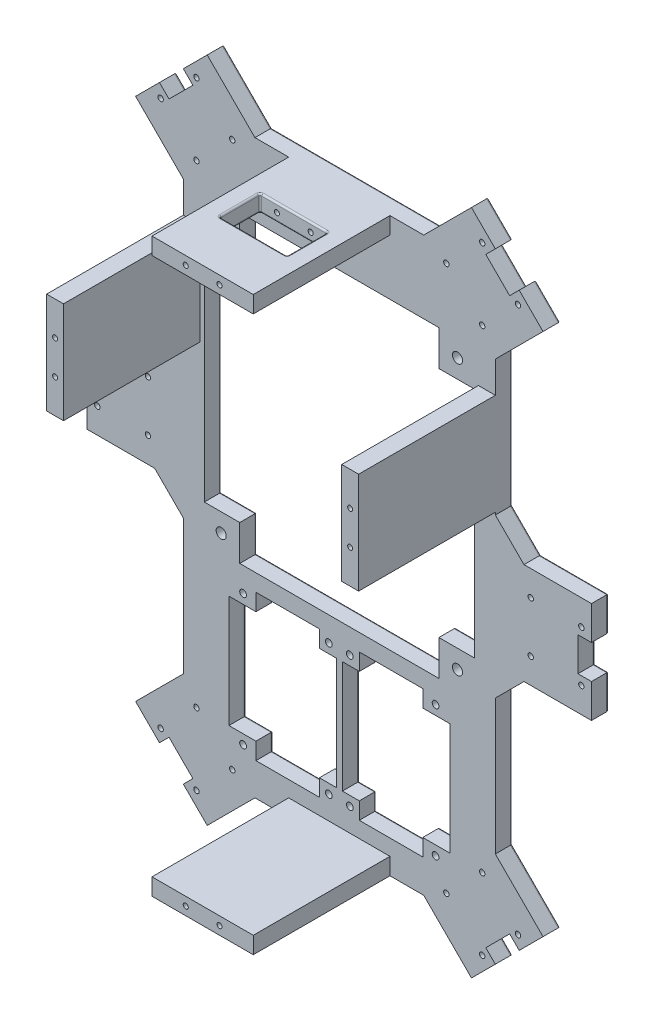
from build123d import *

# Parameters (mm, degrees)
DODANIE_WYCI_GNI_CIE1_DEPTH      = 5
WYTNIJ_WYCI_GNI_CIE3_DEPTH       = 16
WYTNIJ_WYCI_GNI_CIE3_DEPTH_BACK  = 4
SZKIC3_R                         = 0.8
WYTNIJ_WYCI_GNI_CIE4_DEPTH       = 26
WYTNIJ_WYCI_GNI_CIE4_DEPTH_BACK  = 52
SZKIC5_R                         = 1.5
WYTNIJ_WYCI_GNI_CIE5_DEPTH       = 31
WYTNIJ_WYCI_GNI_CIE5_DEPTH_BACK  = 69
WYTNIJ_WYCI_GNI_CIE6_DEPTH       = 22
WYTNIJ_WYCI_GNI_CIE6_DEPTH_BACK  = 83
SZKIC7_R                         = 1
SZKIC8_W                         = 30
SZKIC8_H                         = 5
DODANIE_WYCI_GNI_CIE2_DEPTH      = 45.5
SZKIC10_W                        = 30
SZKIC10_H                        = 5
DODANIE_WYCI_GNI_CIE3_DEPTH      = 40.5
WYTNIJ_WYCI_GNI_CIE7_DEPTH       = 112
WYTNIJ_WYCI_GNI_CIE7_DEPTH_BACK  = 158
SZKIC11_R                        = 0.75
WYTNIJ_WYCI_GNI_CIE8_DEPTH       = 220
WYTNIJ_WYCI_GNI_CIE8_DEPTH_BACK  = 402
SZKIC12_R                        = 0.75
SZKIC13_W                        = 5
SZKIC13_H                        = 30
DODANIE_WYCI_GNI_CIE4_DEPTH      = 40.5
WYTNIJ_WYCI_GNI_CIE9_DEPTH       = 48
WYTNIJ_WYCI_GNI_CIE9_DEPTH_BACK  = 85
SZKIC14_R                        = 0.75
ZAOKR_GLENIE1_R                  = 0.5
WYTNIJ_WYCI_GNI_CIE10_DEPTH      = 19
WYTNIJ_WYCI_GNI_CIE10_DEPTH_BACK = 21
SZKIC15_W                        = 20
SZKIC15_H                        = 12
ZAOKR_GLENIE2_R                  = 0.5


with BuildPart() as part:
    # Szkic1 → Dodanie-wyciągnięcie1 (new body)
    with BuildSketch(Plane.XY):
        Polygon((0, 0), (-50, 0), (-64.142135624, 14.142135624), (-71.213203436, 7.071067812), (-68.384776311, 4.242640687), (-75.455844123, -2.828427125), (-78.284271247, 0), (-85.355339059, -7.071067812), (-71.213203436, -21.213203436), (-71.213203436, -61.213203436), (-79.69848481, -69.69848481), (-99.69848481, -69.69848481), (-99.69848481, -79.69848481), (-95.69848481, -79.69848481), (-95.69848481, -89.69848481), (-99.69848481, -89.69848481), (-99.69848481, -99.69848481), (-79.69848481, -99.69848481), (-71.213203436, -108.183766184), (-71.213203436, -148.183766184), (-85.355339059, -162.325901808), (-78.284271247, -169.39696962), (-75.455844123, -166.568542495), (-68.384776311, -173.639610307), (-71.213203436, -176.468037432), (-64.142135624, -183.539105243), (-50, -169.39696962), (0, -169.39696962), (14.142135624, -183.539105243), (21.213203436, -176.468037432), (18.384776311, -173.639610307), (25.455844123, -166.568542495), (28.284271247, -169.39696962), (35.355339059, -162.325901808), (21.213203436, -148.183766184), (21.213203436, -108.183766184), (29.69848481, -99.69848481), (49.69848481, -99.69848481), (49.69848481, -89.69848481), (45.69848481, -89.69848481), (45.69848481, -79.69848481), (49.69848481, -79.69848481), (49.69848481, -69.69848481), (29.69848481, -69.69848481), (21.213203436, -61.213203436), (21.213203436, -21.213203436), (35.355339059, -7.071067812), (28.284271247, 0), (25.455844123, -2.828427125), (18.384776311, 4.242640687), (21.213203436, 7.071067812), (14.142135624, 14.142135624), align=None)
    extrude(amount=DODANIE_WYCI_GNI_CIE1_DEPTH)

    # Szkic3 → Wytnij-wyciągnięcie3 (cut, two sides: drawn at the far end of the back side and taken through both)
    with BuildSketch(Plane.XY.offset(-WYTNIJ_WYCI_GNI_CIE3_DEPTH_BACK)):
        with Locations((31.69848481, -77.19848481)):
            Circle(SZKIC3_R)
        with Locations((46.69848481, -77.19848481)):
            Circle(SZKIC3_R)
        with Locations((31.69848481, -92.19848481)):
            Circle(SZKIC3_R)
        with Locations((46.69848481, -92.19848481)):
            Circle(SZKIC3_R)
        with Locations((-81.69848481, -77.19848481)):
            Circle(SZKIC3_R)
        with Locations((-96.69848481, -77.19848481)):
            Circle(SZKIC3_R)
        with Locations((17.324116139, -154.901280605)):
            Circle(SZKIC3_R)
        with Locations((27.930717857, -165.507882323)):
            Circle(SZKIC3_R)
        with Locations((17.324116139, -176.114484041)):
            Circle(SZKIC3_R)
        with Locations((6.717514421, -165.507882323)):
            Circle(SZKIC3_R)
        with Locations((-67.324116139, -154.901280605)):
            Circle(SZKIC3_R)
        with Locations((-77.930717857, -165.507882323)):
            Circle(SZKIC3_R)
        with Locations((-67.324116139, -176.114484041)):
            Circle(SZKIC3_R)
        with Locations((-56.717514421, -165.507882323)):
            Circle(SZKIC3_R)
        with Locations((17.324116139, 6.717514421)):
            Circle(SZKIC3_R)
        with Locations((27.930717857, -3.889087297)):
            Circle(SZKIC3_R)
        with Locations((6.717514421, -3.889087297)):
            Circle(SZKIC3_R)
        with Locations((17.324116139, -14.495689014)):
            Circle(SZKIC3_R)
        with Locations((-67.324116139, 6.717514421)):
            Circle(SZKIC3_R)
        with Locations((-56.717514421, -3.889087297)):
            Circle(SZKIC3_R)
        with Locations((-77.930717857, -3.889087297)):
            Circle(SZKIC3_R)
        with Locations((-67.324116139, -14.495689014)):
            Circle(SZKIC3_R)
        with Locations((-96.69848481, -92.19848481)):
            Circle(SZKIC3_R)
        with Locations((-81.69848481, -92.19848481)):
            Circle(SZKIC3_R)
    extrude(amount=WYTNIJ_WYCI_GNI_CIE3_DEPTH + WYTNIJ_WYCI_GNI_CIE3_DEPTH_BACK, mode=Mode.SUBTRACT)

    # Szkic5 → Wytnij-wyciągnięcie4 (cut, two sides: drawn at the far end of the back side and taken through both)
    with BuildSketch(Plane.XY.offset(-WYTNIJ_WYCI_GNI_CIE4_DEPTH_BACK)):
        with Locations((-60.003203436, -26.5)):
            Circle(SZKIC5_R)
        with Locations((9.996796564, -26.5)):
            Circle(SZKIC5_R)
        with Locations((9.996796564, -106.5)):
            Circle(SZKIC5_R)
        with Locations((-60.003203436, -106.5)):
            Circle(SZKIC5_R)
        Polygon((4.496796564, -21.5), (-54.503203436, -21.5), (-54.503203436, -32), (-65.003203436, -32), (-65.003203436, -101), (-54.503203436, -101), (-54.503203436, -111.5), (4.496796564, -111.5), (4.496796564, -101), (14.996796564, -101), (14.996796564, -32), (4.496796564, -32), align=None)
    extrude(amount=WYTNIJ_WYCI_GNI_CIE4_DEPTH + WYTNIJ_WYCI_GNI_CIE4_DEPTH_BACK, mode=Mode.SUBTRACT)

    # Szkic6 → Wytnij-wyciągnięcie5 (cut, two sides: drawn at the far end of the back side and taken through both)
    with BuildSketch(Plane.XY.offset(5).offset(-WYTNIJ_WYCI_GNI_CIE5_DEPTH_BACK)):
        Polygon((-30.913203436, -116.49696962), (-49.713203436, -116.49696962), (-49.713203436, -121.49696962), (-57.713203436, -121.49696962), (-57.713203436, -154.69696962), (-49.713203436, -154.69696962), (-49.713203436, -159.69696962), (-30.913203436, -159.69696962), (-30.913203436, -154.69696962), (-25.913203436, -154.69696962), (-25.913203436, -121.49696962), (-30.913203436, -121.49696962), align=None)
        Polygon((-0.286796564, -121.49696962), (-0.286796564, -116.49696962), (-19.086796564, -116.49696962), (-19.086796564, -121.49696962), (-24.086796564, -121.49696962), (-24.086796564, -154.69696962), (-19.086796564, -154.69696962), (-19.086796564, -159.69696962), (-0.286796564, -159.69696962), (-0.286796564, -154.69696962), (7.713203436, -154.69696962), (7.713203436, -121.49696962), align=None)
    extrude(amount=WYTNIJ_WYCI_GNI_CIE5_DEPTH + WYTNIJ_WYCI_GNI_CIE5_DEPTH_BACK, mode=Mode.SUBTRACT)

    # Szkic7 → Wytnij-wyciągnięcie6 (cut, two sides: drawn at the far end of the back side and taken through both)
    with BuildSketch(Plane.XY.offset(5).offset(-WYTNIJ_WYCI_GNI_CIE6_DEPTH_BACK)):
        with Locations((-53.513203436, -118.69696962)):
            Circle(SZKIC7_R)
        with Locations((-28.113203436, -118.69696962)):
            Circle(SZKIC7_R)
        with Locations((-21.886796564, -118.69696962)):
            Circle(SZKIC7_R)
        with Locations((3.513203436, -118.69696962)):
            Circle(SZKIC7_R)
        with Locations((3.513203436, -157.49696962)):
            Circle(SZKIC7_R)
        with Locations((-21.886796564, -157.49696962)):
            Circle(SZKIC7_R)
        with Locations((-28.113203436, -157.49696962)):
            Circle(SZKIC7_R)
        with Locations((-53.513203436, -157.49696962)):
            Circle(SZKIC7_R)
    extrude(amount=WYTNIJ_WYCI_GNI_CIE6_DEPTH + WYTNIJ_WYCI_GNI_CIE6_DEPTH_BACK, mode=Mode.SUBTRACT)

    # Szkic8 → Dodanie-wyciągnięcie2 (add)
    with BuildSketch(Plane.XY):
        with Locations((-25, -2.5)):
            Rectangle(SZKIC8_W, SZKIC8_H)
    extrude(amount=DODANIE_WYCI_GNI_CIE2_DEPTH)

    # Szkic10 → Dodanie-wyciągnięcie3 (add)
    with BuildSketch(Plane.XY.offset(5)):
        with Locations((-25, -166.89696962)):
            Rectangle(SZKIC10_W, SZKIC10_H)
    extrude(amount=DODANIE_WYCI_GNI_CIE3_DEPTH)

    # Szkic11 → Wytnij-wyciągnięcie7 (cut, two sides: drawn at the far end of the back side and taken through both)
    with BuildSketch(Plane.XY.offset(45.5).offset(-WYTNIJ_WYCI_GNI_CIE7_DEPTH_BACK)):
        with Locations((-30, -2.5)):
            Circle(SZKIC11_R)
        with Locations((-20, -2.5)):
            Circle(SZKIC11_R)
    extrude(amount=WYTNIJ_WYCI_GNI_CIE7_DEPTH + WYTNIJ_WYCI_GNI_CIE7_DEPTH_BACK, mode=Mode.SUBTRACT)

    # Szkic12 → Wytnij-wyciągnięcie8 (cut, two sides: drawn at the far end of the back side and taken through both)
    with BuildSketch(Plane.XY.offset(45.5).offset(-WYTNIJ_WYCI_GNI_CIE8_DEPTH_BACK)):
        with Locations((-30, -166.89696962)):
            Circle(SZKIC12_R)
        with Locations((-20, -166.89696962)):
            Circle(SZKIC12_R)
    extrude(amount=WYTNIJ_WYCI_GNI_CIE8_DEPTH + WYTNIJ_WYCI_GNI_CIE8_DEPTH_BACK, mode=Mode.SUBTRACT)

    # Szkic13 → Dodanie-wyciągnięcie4 (add)
    with BuildSketch(Plane.XY.offset(5)):
        with Locations((-68.713203436, -45.5)):
            Rectangle(SZKIC13_W, SZKIC13_H)
        with Locations((18.713203436, -45.5)):
            Rectangle(SZKIC13_W, SZKIC13_H)
    extrude(amount=DODANIE_WYCI_GNI_CIE4_DEPTH)

    # Szkic14 → Wytnij-wyciągnięcie9 (cut, two sides: drawn at the far end of the back side and taken through both)
    with BuildSketch(Plane.XY.offset(-WYTNIJ_WYCI_GNI_CIE9_DEPTH_BACK)):
        with Locations((-68.713203436, -40.5)):
            Circle(SZKIC14_R)
        with Locations((-68.713203436, -50.5)):
            Circle(SZKIC14_R)
        with Locations((18.713203436, -40.5)):
            Circle(SZKIC14_R)
        with Locations((18.713203436, -50.5)):
            Circle(SZKIC14_R)
    extrude(amount=WYTNIJ_WYCI_GNI_CIE9_DEPTH + WYTNIJ_WYCI_GNI_CIE9_DEPTH_BACK, mode=Mode.SUBTRACT)

    # Zaokrąglenie1
    zaokr_glenie1_edges = [part.edges().sort_by_distance(p)[0] for p in [
        (-97.49848481, -77.19848481, 0),
        (-82.49848481, -77.19848481, 0),
        (-97.49848481, -92.19848481, 0),
        (-68.124116139, -176.114484041, 0),
        (-82.49848481, -92.19848481, 0),
        (-29.113203436, -118.69696962, 0),
        (-22.886796564, -118.69696962, 0),
        (2.513203436, -118.69696962, 0),
        (2.513203436, -157.49696962, 0),
        (-22.886796564, -157.49696962, 0),
        (-29.113203436, -157.49696962, 0),
        (-54.513203436, -157.49696962, 0),
        (-54.513203436, -118.69696962, 0),
        (-0.286796564, -118.99696962, 0),
        (3.713203436, -121.49696962, 0),
        (7.713203436, -138.09696962, 0),
        (3.713203436, -154.69696962, 0),
        (-0.286796564, -157.19696962, 0),
        (-9.686796564, -159.69696962, 0),
        (-19.086796564, -157.19696962, 0),
        (-21.586796564, -154.69696962, 0),
        (-24.086796564, -138.09696962, 0),
        (-21.586796564, -121.49696962, 0),
        (-19.086796564, -118.99696962, 0),
        (-9.686796564, -116.49696962, 0),
        (30.89848481, -77.19848481, 0),
        (-57.517514421, -3.889087297, 0),
        (-78.730717857, -3.889087297, 0),
        (-68.124116139, -14.495689014, 0),
        (-68.124116139, -154.901280605, 0),
        (5.917514421, -165.507882323, 0),
        (27.130717857, -165.507882323, 0),
        (16.524116139, -154.901280605, 0),
        (45.89848481, -77.19848481, 0),
        (30.89848481, -92.19848481, 0),
        (45.89848481, -92.19848481, 0),
        (16.524116139, -176.114484041, 0),
        (27.130717857, -3.889087297, 0),
        (5.917514421, -3.889087297, 0),
        (16.524116139, -14.495689014, 0),
        (-68.124116139, 6.717514421, 0),
        (16.524116139, 6.717514421, 0),
        (-57.517514421, -165.507882323, 0),
        (-78.730717857, -165.507882323, 0),
        (9.746796564, -32, 0),
        (14.996796564, -66.5, 0),
        (9.746796564, -101, 0),
        (4.496796564, -106.25, 0),
        (-25.003203436, -111.5, 0),
        (-54.503203436, -106.25, 0),
        (-59.753203436, -101, 0),
        (-65.003203436, -66.5, 0),
        (-59.753203436, -32, 0),
        (-54.503203436, -26.75, 0),
        (-25.003203436, -21.5, 0),
        (4.496796564, -26.75, 0),
        (-61.503203436, -26.5, 0),
        (8.496796564, -26.5, 0),
        (8.496796564, -106.5, 0),
        (-61.503203436, -106.5, 0),
        (-28.413203436, -121.49696962, 0),
        (-25.913203436, -138.09696962, 0),
        (-28.413203436, -154.69696962, 0),
        (-30.913203436, -157.19696962, 0),
        (-40.313203436, -159.69696962, 0),
        (-49.713203436, -157.19696962, 0),
        (-53.713203436, -154.69696962, 0),
        (-57.713203436, -138.09696962, 0),
        (-53.713203436, -121.49696962, 0),
        (-49.713203436, -118.99696962, 0),
        (-40.313203436, -116.49696962, 0),
        (-30.913203436, -118.99696962, 0),
        (-67.67766953, 10.606601718, 0),
        (-69.798989873, 5.656854249, 0),
        (-71.920310217, 0.707106781, 0),
        (-76.870057685, -1.414213562, 0),
        (-81.819805153, -3.535533906, 0),
        (-78.284271247, -14.142135624, 0),
        (-71.213203436, -41.213203436, 0),
        (-75.455844123, -65.455844123, 0),
        (-89.69848481, -69.69848481, 0),
        (-99.69848481, -74.69848481, 0),
        (-97.69848481, -79.69848481, 0),
        (-95.69848481, -84.69848481, 0),
        (-97.69848481, -89.69848481, 0),
        (-99.69848481, -94.69848481, 0),
        (-89.69848481, -99.69848481, 0),
        (-75.455844123, -103.941125497, 0),
        (-71.213203436, -128.183766184, 0),
        (-78.284271247, -155.254833996, 0),
        (-81.819805153, -165.861435714, 0),
        (-76.870057685, -167.982756057, 0),
        (-71.920310217, -170.104076401, 0),
        (-69.798989873, -175.053823869, 0),
        (-67.67766953, -180.003571337, 0),
        (-57.071067812, -176.468037432, 0),
        (-25, -169.39696962, 0),
        (7.071067812, -176.468037432, 0),
        (17.67766953, -180.003571337, 0),
        (19.798989873, -175.053823869, 0),
        (21.920310217, -170.104076401, 0),
        (26.870057685, -167.982756057, 0),
        (31.819805153, -165.861435714, 0),
        (28.284271247, -155.254833996, 0),
        (21.213203436, -128.183766184, 0),
        (25.455844123, -103.941125497, 0),
        (39.69848481, -99.69848481, 0),
        (49.69848481, -94.69848481, 0),
        (47.69848481, -89.69848481, 0),
        (45.69848481, -84.69848481, 0),
        (47.69848481, -79.69848481, 0),
        (49.69848481, -74.69848481, 0),
        (39.69848481, -69.69848481, 0),
        (25.455844123, -65.455844123, 0),
        (21.213203436, -41.213203436, 0),
        (28.284271247, -14.142135624, 0),
        (31.819805153, -3.535533906, 0),
        (26.870057685, -1.414213562, 0),
        (21.920310217, 0.707106781, 0),
        (19.798989873, 5.656854249, 0),
        (17.67766953, 10.606601718, 0),
        (7.071067812, 7.071067812, 0),
        (-25, 0, 0),
        (-57.071067812, 7.071067812, 0),
        (-20.75, -2.5, 0),
        (-30.75, -2.5, 0),
        (-20.75, -166.89696962, 0),
        (-30.75, -166.89696962, 0),
        (-69.463203436, -40.5, 0),
        (17.963203436, -50.5, 0),
        (17.963203436, -40.5, 0),
        (-69.463203436, -50.5, 0),
    ]]
    fillet(zaokr_glenie1_edges, radius=ZAOKR_GLENIE1_R)

    # Szkic15 → Wytnij-wyciągnięcie10 (cut, two sides: drawn at the far end of the back side and taken through both)
    with BuildSketch(Plane(origin=(0, 0, 0), x_dir=(1, 0, 0), z_dir=(0, 1, 0)).offset(-WYTNIJ_WYCI_GNI_CIE10_DEPTH_BACK)):
        with Locations((-25, -24.5)):
            Rectangle(SZKIC15_W, SZKIC15_H)
    extrude(amount=WYTNIJ_WYCI_GNI_CIE10_DEPTH + WYTNIJ_WYCI_GNI_CIE10_DEPTH_BACK, mode=Mode.SUBTRACT)

    # Zaokrąglenie2
    zaokr_glenie2_edges = [part.edges().sort_by_distance(p)[0] for p in [
        (-25, -5, 18.5),
        (-25, -5, 30.5),
        (-15, -2.5, 30.5),
        (-15, -5, 24.5),
        (-15, -2.5, 18.5),
        (-15, 0, 24.5),
        (-35, -2.5, 18.5),
        (-35, -5, 24.5),
        (-35, -2.5, 30.5),
        (-35, 0, 24.5),
        (-25, 0, 18.5),
        (-25, 0, 30.5),
    ]]
    fillet(zaokr_glenie2_edges, radius=ZAOKR_GLENIE2_R)


solid = part.part
